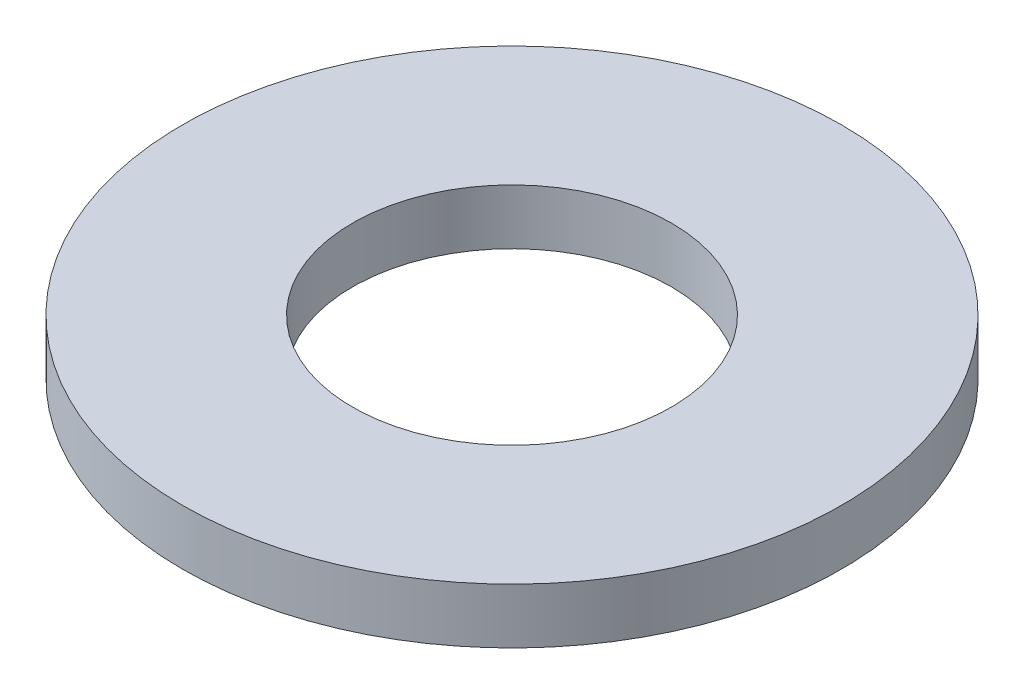
from build123d import *

# Parameters (mm, degrees)
SKETCH1_R           = 77.5
BOSS_EXTRUDE1_DEPTH = 13
SKETCH2_R           = 37.5
CUT_EXTRUDE1_DEPTH  = 111.369832835


with BuildPart() as part:
    # Sketch1 → Boss-Extrude1 (new body)
    with BuildSketch(Plane(origin=(0, 0, 0), x_dir=(1, 0, 0), z_dir=(0, 1, 0))):
        Circle(SKETCH1_R)
    extrude(amount=BOSS_EXTRUDE1_DEPTH)

    # Sketch2 → Cut-Extrude1 (cut, through all)
    with BuildSketch(Plane(origin=(0, 0, 0), x_dir=(1, 0, 0), z_dir=(0, 1, 0))):
        Circle(SKETCH2_R)
    extrude(amount=CUT_EXTRUDE1_DEPTH, mode=Mode.SUBTRACT)


solid = part.part
